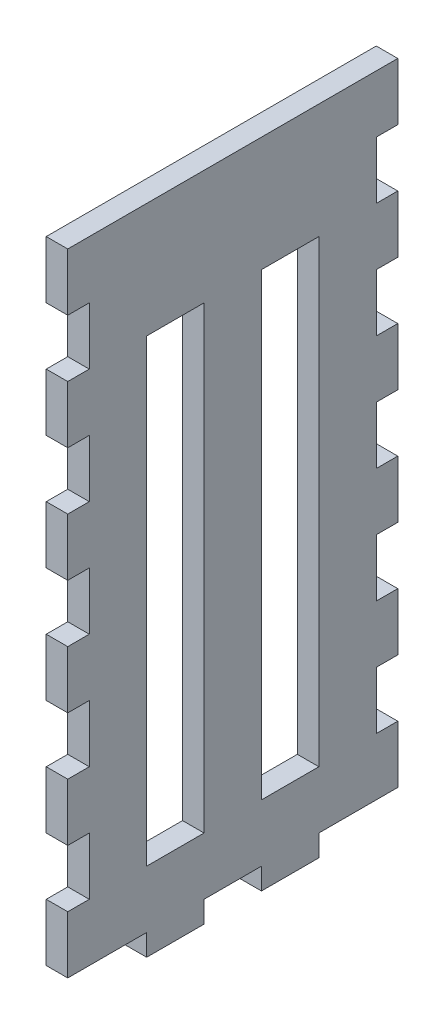
from build123d import *

# Parameters (mm, degrees)
SKETCH1_W               = 127
SKETCH1_H               = 279.4
BOSS_EXTRUDE1_DEPTH     = 9.525
SKETCH2_W               = 9.525
SKETCH2_H               = 25.4
BOSS_EXTRUDE2_DEPTH     = 9.525
LPATTERN1_COUNT         = 6
LPATTERN1_PITCH         = 50.8
MIRROR1_COPY_1_SKETCH_W = 9.525
MIRROR1_COPY_1_SKETCH_H = 25.4
MIRROR1_COPY_1_DEPTH    = 9.525
MIRROR1_COPY_2_SKETCH_W = 9.525
MIRROR1_COPY_2_SKETCH_H = 25.4
MIRROR1_COPY_2_DEPTH    = 9.525
MIRROR1_COPY_3_SKETCH_W = 9.525
MIRROR1_COPY_3_SKETCH_H = 25.4
MIRROR1_COPY_3_DEPTH    = 9.525
MIRROR1_COPY_4_SKETCH_W = 9.525
MIRROR1_COPY_4_SKETCH_H = 25.4
MIRROR1_COPY_4_DEPTH    = 9.525
MIRROR1_COPY_5_SKETCH_W = 9.525
MIRROR1_COPY_5_SKETCH_H = 25.4
MIRROR1_COPY_5_DEPTH    = 9.525
MIRROR1_COPY_6_SKETCH_W = 9.525
MIRROR1_COPY_6_SKETCH_H = 25.4
MIRROR1_COPY_6_DEPTH    = 9.525
SKETCH3_W               = 9.525
SKETCH3_H               = 25.4
BOSS_EXTRUDE3_DEPTH     = 9.525
LPATTERN2_COUNT         = 2
LPATTERN2_PITCH         = 50.8
SKETCH4_W               = 25.4
SKETCH4_H               = 203.2
CUT_EXTRUDE1_DEPTH      = 9.525


with BuildPart() as part:
    # Sketch1 → Boss-Extrude1 (new body)
    with BuildSketch(Plane(origin=(0, 0, 0), x_dir=(0, 0, -1), z_dir=(1, 0, 0))):
        Rectangle(SKETCH1_W, SKETCH1_H)
    extrude(amount=BOSS_EXTRUDE1_DEPTH)

    # Sketch2 → Boss-Extrude2 (add)
    with BuildSketch(Plane.XY.offset(63.5)):
        with Locations((4.7625, 127)):
            Rectangle(SKETCH2_W, SKETCH2_H)
    boss_extrude2 = extrude(amount=BOSS_EXTRUDE2_DEPTH)

    # LPattern1: Boss-Extrude2 ×6
    with Locations(*[(0, -i * LPATTERN1_PITCH, 0) for i in range(1, LPATTERN1_COUNT)]):
        add(boss_extrude2)

    # Mirror1 copy 1 sketch → Mirror1 copy 1 (add)
    with BuildSketch(Plane(origin=(0, -50.8, -63.5), x_dir=(1, 0, 0), z_dir=(0, 0, -1))):
        with Locations((4.7625, -127)):
            Rectangle(MIRROR1_COPY_1_SKETCH_W, MIRROR1_COPY_1_SKETCH_H)
    extrude(amount=MIRROR1_COPY_1_DEPTH)

    # Mirror1 copy 2 sketch → Mirror1 copy 2 (add)
    with BuildSketch(Plane(origin=(0, -101.6, -63.5), x_dir=(1, 0, 0), z_dir=(0, 0, -1))):
        with Locations((4.7625, -127)):
            Rectangle(MIRROR1_COPY_2_SKETCH_W, MIRROR1_COPY_2_SKETCH_H)
    extrude(amount=MIRROR1_COPY_2_DEPTH)

    # Mirror1 copy 3 sketch → Mirror1 copy 3 (add)
    with BuildSketch(Plane(origin=(0, -152.4, -63.5), x_dir=(1, 0, 0), z_dir=(0, 0, -1))):
        with Locations((4.7625, -127)):
            Rectangle(MIRROR1_COPY_3_SKETCH_W, MIRROR1_COPY_3_SKETCH_H)
    extrude(amount=MIRROR1_COPY_3_DEPTH)

    # Mirror1 copy 4 sketch → Mirror1 copy 4 (add)
    with BuildSketch(Plane(origin=(0, -203.2, -63.5), x_dir=(1, 0, 0), z_dir=(0, 0, -1))):
        with Locations((4.7625, -127)):
            Rectangle(MIRROR1_COPY_4_SKETCH_W, MIRROR1_COPY_4_SKETCH_H)
    extrude(amount=MIRROR1_COPY_4_DEPTH)

    # Mirror1 copy 5 sketch → Mirror1 copy 5 (add)
    with BuildSketch(Plane(origin=(0, -254, -63.5), x_dir=(1, 0, 0), z_dir=(0, 0, -1))):
        with Locations((4.7625, -127)):
            Rectangle(MIRROR1_COPY_5_SKETCH_W, MIRROR1_COPY_5_SKETCH_H)
    extrude(amount=MIRROR1_COPY_5_DEPTH)

    # Mirror1 copy 6 sketch → Mirror1 copy 6 (add)
    with BuildSketch(Plane(origin=(0, 0, -63.5), x_dir=(1, 0, 0), z_dir=(0, 0, -1))):
        with Locations((4.7625, -127)):
            Rectangle(MIRROR1_COPY_6_SKETCH_W, MIRROR1_COPY_6_SKETCH_H)
    extrude(amount=MIRROR1_COPY_6_DEPTH)

    # Sketch3 → Boss-Extrude3 (add)
    with BuildSketch(Plane.XZ.offset(139.7)):
        with Locations((4.7625, 25.4)):
            Rectangle(SKETCH3_W, SKETCH3_H)
    boss_extrude3 = extrude(amount=BOSS_EXTRUDE3_DEPTH)

    # LPattern2: Boss-Extrude3 ×2
    with Locations(*[(0, 0, -i * LPATTERN2_PITCH) for i in range(1, LPATTERN2_COUNT)]):
        add(boss_extrude3)

    # Sketch4 → Cut-Extrude1 (cut)
    with BuildSketch(Plane(origin=(9.525, 0, 0), x_dir=(0, 0, -1), z_dir=(1, 0, 0))):
        with Locations((-25.4, -12.7)):
            Rectangle(SKETCH4_W, SKETCH4_H)
    cut_extrude1 = extrude(amount=-CUT_EXTRUDE1_DEPTH, mode=Mode.SUBTRACT)

    # Mirror2: Cut-Extrude1 across plane
    add(cut_extrude1.mirror(Plane.XY), mode=Mode.SUBTRACT)


solid = part.part
